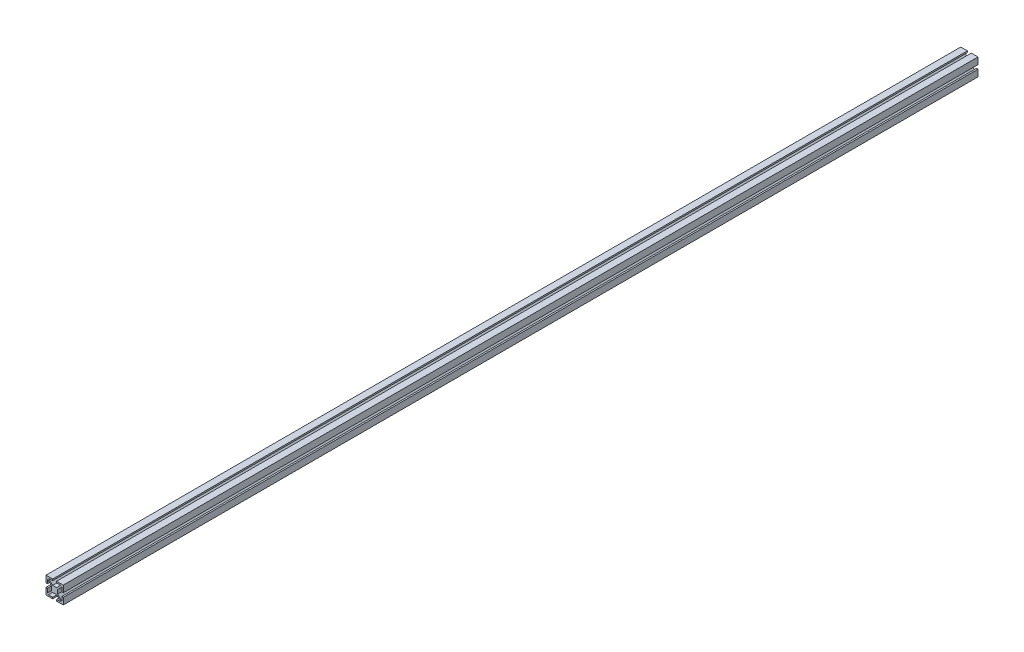
from build123d import *

# Parameters (mm, degrees)
EXTRUDE1_DEPTH = 1346.2


# Read off the part's stored shape, not the designer's step: 1010<1>
with BuildPart() as part:
    # Sketch1<2> → Extrude1 (new body)
    with BuildSketch(Plane.XY):
        Polygon((10.030020765, -6.992412451), (19.865235782, -6.992412451), (19.865235782, -9.202212451), (13.80238533, -9.202212451), (19.78408533, -15.183912451), (25.6759562, -15.183912451), (31.6576562, -9.202212451), (25.594805747, -9.202212451), (25.594805747, -6.992412451), (35.430020765, -6.992412451), (35.430020765, -16.827627469), (33.220220765, -16.827627469), (33.220220765, -10.764777016), (27.238520765, -16.746477016), (27.238520765, -22.638347886), (33.220220765, -28.620047886), (33.220220765, -22.557197434), (35.430020765, -22.557197434), (35.430020765, -32.392412451), (25.594805747, -32.392412451), (25.594805747, -30.182612451), (31.6576562, -30.182612451), (25.6759562, -24.200912451), (19.78408533, -24.200912451), (13.80238533, -30.182612451), (19.865235782, -30.182612451), (19.865235782, -32.392412451), (10.030020765, -32.392412451), (10.030020765, -22.557197434), (12.239820765, -22.557197434), (12.239820765, -28.620047886), (18.221520765, -22.638347886), (18.221520765, -16.746477016), (12.239820765, -10.764777016), (12.239820765, -16.827627469), (10.030020765, -16.827627469), align=None)
    extrude(amount=EXTRUDE1_DEPTH)


solid = part.part
